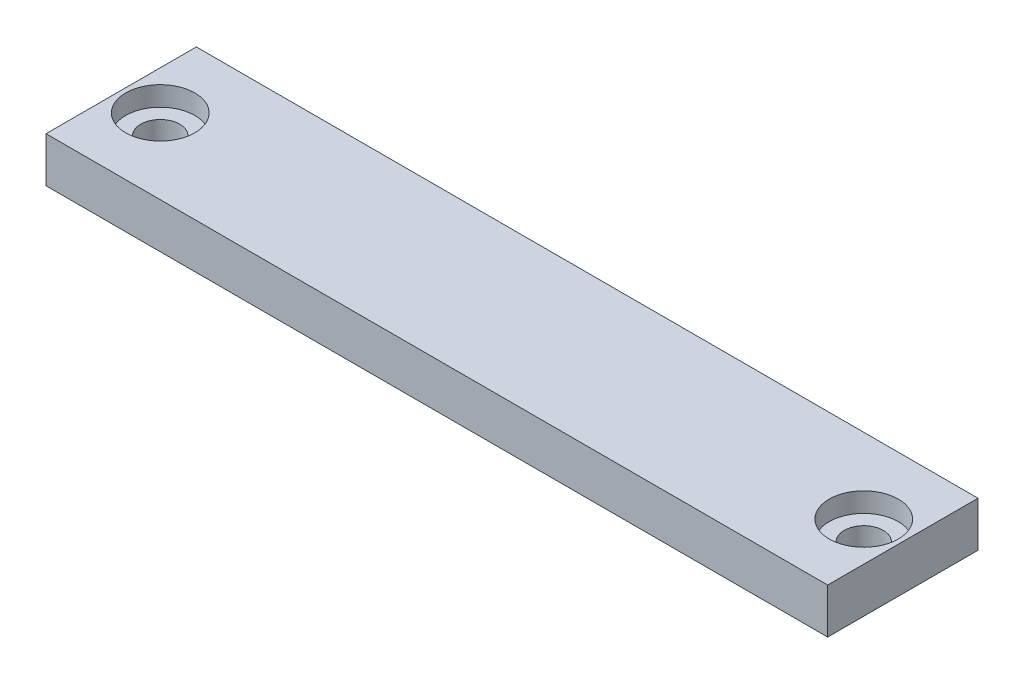
from build123d import *

# Parameters (mm, degrees)
BOSS_EXTRUDE1_START = -40
SKETCH1_W           = 52
SKETCH1_H           = 3
BOSS_EXTRUDE1_DEPTH = 10
BOSS_EXTRUDE2_START = 20
SKETCH2_R           = 1.3
BOSS_EXTRUDE2_DEPTH = 6
BOSS_EXTRUDE3_START = 23.45
SKETCH3_R           = 2.3
BOSS_EXTRUDE3_DEPTH = 2.55
BOSS_EXTRUDE4_START = 20
SKETCH4_R           = 1.3
BOSS_EXTRUDE4_DEPTH = 6
BOSS_EXTRUDE5_START = 23.45
SKETCH5_R           = 2.3
BOSS_EXTRUDE5_DEPTH = 2.55


with BuildPart() as part:
    # Sketch1 → Boss-Extrude1 (new body)
    with BuildSketch(Plane.XY.offset(BOSS_EXTRUDE1_START)):
        with Locations((0, 23.25)):
            Rectangle(SKETCH1_W, SKETCH1_H)
    extrude(amount=BOSS_EXTRUDE1_DEPTH)


with BuildPart() as body_2:
    # Sketch2 → Boss-Extrude2 (new body)
    with BuildSketch(Plane(origin=(0, 0, 0), x_dir=(1, 0, 0), z_dir=(0, 1, 0)).offset(BOSS_EXTRUDE2_START)):
        with Locations((-23.4, 35)):
            Circle(SKETCH2_R)
    extrude(amount=BOSS_EXTRUDE2_DEPTH)


with BuildPart() as part_1:
    add(part.part)

    # Combine1: cut body 2
    add(body_2.part, mode=Mode.SUBTRACT)


with BuildPart() as body_2_2:
    # Sketch3 → Boss-Extrude3 (new body)
    with BuildSketch(Plane(origin=(0, 0, 0), x_dir=(1, 0, 0), z_dir=(0, 1, 0)).offset(BOSS_EXTRUDE3_START)):
        with Locations((-23.4, 35)):
            Circle(SKETCH3_R)
    extrude(amount=BOSS_EXTRUDE3_DEPTH)


with BuildPart() as part_2:
    add(part_1.part)

    # Combine2: cut body 2 2
    add(body_2_2.part, mode=Mode.SUBTRACT)


with BuildPart() as body_2_3:
    # Sketch4 → Boss-Extrude4 (new body)
    with BuildSketch(Plane(origin=(0, 0, 0), x_dir=(1, 0, 0), z_dir=(0, 1, 0)).offset(BOSS_EXTRUDE4_START)):
        with Locations((23.4, 35)):
            Circle(SKETCH4_R)
    extrude(amount=BOSS_EXTRUDE4_DEPTH)


with BuildPart() as part_3:
    add(part_2.part)

    # Combine3: cut body 2 3
    add(body_2_3.part, mode=Mode.SUBTRACT)


with BuildPart() as body_2_4:
    # Sketch5 → Boss-Extrude5 (new body)
    with BuildSketch(Plane(origin=(0, 0, 0), x_dir=(1, 0, 0), z_dir=(0, 1, 0)).offset(BOSS_EXTRUDE5_START)):
        with Locations((23.4, 35)):
            Circle(SKETCH5_R)
    extrude(amount=BOSS_EXTRUDE5_DEPTH)


with BuildPart() as part_4:
    add(part_3.part)

    # Combine4: cut body 2 4
    add(body_2_4.part, mode=Mode.SUBTRACT)


solid = part_4.part
